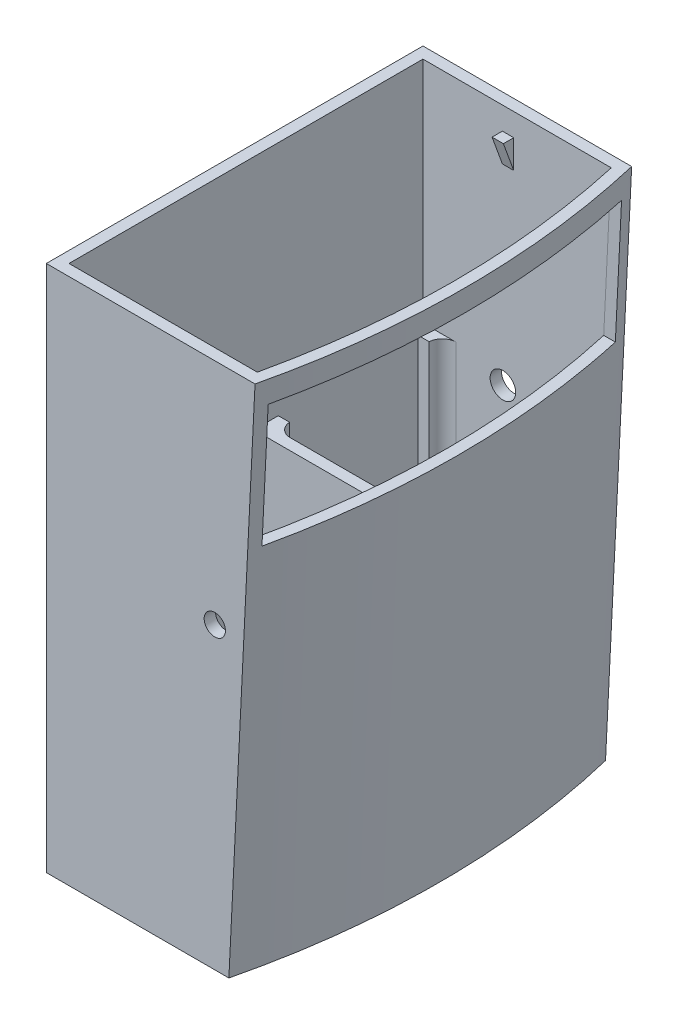
from build123d import *

# Parameters (mm, degrees)
SHELL1_T               = -2
BOSS_EXTRUDE1_START    = 2
SKETCH7_4_W            = 2
SKETCH7_4_H            = 2.3
BOSS_EXTRUDE1_DEPTH    = 50.7
FILLET1_R              = 2.4
CUT_EXTRUDE1_START     = -40.445352697
CUT_EXTRUDE1_OUTLINE_W = 62.3
CUT_EXTRUDE1_OUTLINE_H = 22.2
CUT_EXTRUDE1_DEPTH     = 6.532429258
BOSS_EXTRUDE2_DEPTH    = 1
SKETCH11_R             = 2.25
CUT_EXTRUDE2_DEPTH     = 2
SKETCH12_R             = 1.875
CUT_EXTRUDE3_DEPTH     = 2


# Read off the part's stored shape, not the designer's step: Cut-Extrude1
with BuildPart() as part:
    # Sketch7 → Loft1 section 0
    with BuildSketch(Plane(origin=(0, 0, 0), x_dir=(1, 0, 0), z_dir=(0, 1, 0))):
        with BuildLine():
            Line((0, 66.4), (32.183064352, 66.4))
            ThreePointArc((32.183064352, 66.4), (36.140979043, 33.2), (32.183064352, 0))
            Line((32.183064352, 0), (0, 0))
            Line((0, 0), (0, 66.4))
        make_face()
    # Sketch1 → Loft1 section 1
    with BuildSketch(Plane(origin=(0, 93, 0), x_dir=(1, 0, 0), z_dir=(0, 1, 0))):
        with BuildLine():
            Line((0, 66.4), (0, 0))
            Line((0, 0), (36.793809788, 0))
            ThreePointArc((36.793809788, 0), (40.63882203, 33.2), (36.793809788, 66.4))
            Line((36.793809788, 66.4), (0, 66.4))
        make_face()
    loft()

    # Shell1
    shell1_openings = [part.faces().sort_by_distance(p)[0] for p in [
        (19.698634873, 93, -33.2),
    ]]
    offset(amount=SHELL1_T, openings=shell1_openings, kind=Kind.INTERSECTION)

    # Sketch7<4> → Boss-Extrude1 (add)
    with BuildSketch(Plane(origin=(0, 0, 0), x_dir=(1, 0, 0), z_dir=(0, 1, 0)).offset(BOSS_EXTRUDE1_START)):
        Polygon((2, 35.2), (2, 33.2), (24.2, 33.2), (24.2, 2), (26.2, 2), (26.2, 35.2), (5.4, 35.2), (3.4, 35.2), align=None)
        with Locations((4.4, 36.35)):
            Rectangle(SKETCH7_4_W, SKETCH7_4_H)
        with Locations((4.4, 63.25)):
            Rectangle(SKETCH7_4_W, SKETCH7_4_H)
    extrude(amount=BOSS_EXTRUDE1_DEPTH)

    # Fillet1
    # the kernel refuses this fillet: 2.4 mm, written as the material it adds along each edge
    with BuildSketch(Plane(origin=(5.4, 2, -35.2), x_dir=(1, 0, 0), z_dir=(0, 1, 0))) as fillet1_piece_1:
        with BuildLine():
            CenterArc((2.397915762, 2.4), FILLET1_R, 182.388015463, 87.611984537)
            Line((0, 2.3), (-0.047958315, 2.298))
            ThreePointArc((-0.047958315, 2.298), (-0.048, 1.15), (-0.048, 0))
            Line((-0.048, 0), (0, -0.048))
            Line((0, -0.048), (2.397915762, -0.048))
            Line((2.397915762, -0.048), (2.397915762, 0))
        make_face()
    extrude(amount=50.7)
    with BuildSketch(Plane(origin=(5.4, 2, -64.4), x_dir=(1, 0, 0), z_dir=(0, 1, 0))) as fillet1_piece_2:
        with BuildLine():
            CenterArc((2.397915762, -2.4), FILLET1_R, 90, 87.611984537)
            Line((0, -2.3), (-0.047958315, -2.298))
            ThreePointArc((-0.047958315, -2.298), (-0.048, -1.15), (-0.048, 0))
            Line((-0.048, 0), (0, 0.048))
            Line((0, 0.048), (2.397915762, 0.048))
            Line((2.397915762, 0.048), (2.397915762, 0))
        make_face()
    extrude(amount=50.7)

    # Cut-Extrude1 outline → Cut-Extrude1 (cut)
    with BuildSketch(Plane.ZY.offset(CUT_EXTRUDE1_START)):
        with Locations((-33.2, 77.9)):
            Rectangle(CUT_EXTRUDE1_OUTLINE_W, CUT_EXTRUDE1_OUTLINE_H)
    extrude(amount=CUT_EXTRUDE1_DEPTH, mode=Mode.SUBTRACT)

    # Sketch10 → Boss-Extrude2 (add, symmetric)
    with BuildSketch(Plane(origin=(17, 0, 0), x_dir=(0, 0, -1), z_dir=(1, 0, 0))):
        Polygon((62.578627716, 89), (64.578627716, 83.505045161), (64.578627716, 89), align=None)
    boss_extrude2 = extrude(amount=BOSS_EXTRUDE2_DEPTH, both=True)

    # Sketch11 → Cut-Extrude2 (cut)
    with BuildSketch(Plane(origin=(0, 0, -66.4), x_dir=(-1, 0, 0), z_dir=(0, 0, -1))):
        with Locations((-16.091532176, 50.25)):
            Circle(SKETCH11_R)
    extrude(amount=-CUT_EXTRUDE2_DEPTH, mode=Mode.SUBTRACT)

    # Sketch12 → Cut-Extrude3 (cut)
    with BuildSketch(Plane(origin=(0, 0, -2), x_dir=(-1, 0, 0), z_dir=(0, 0, -1))):
        with Locations((-29.702128484, 52.7)):
            Circle(SKETCH12_R)
    extrude(amount=-CUT_EXTRUDE3_DEPTH, mode=Mode.SUBTRACT)

    # Mirror1: Boss-Extrude2 across plane
    add(boss_extrude2.mirror(Plane.XY.offset(-33.2)))


solid = part.part
